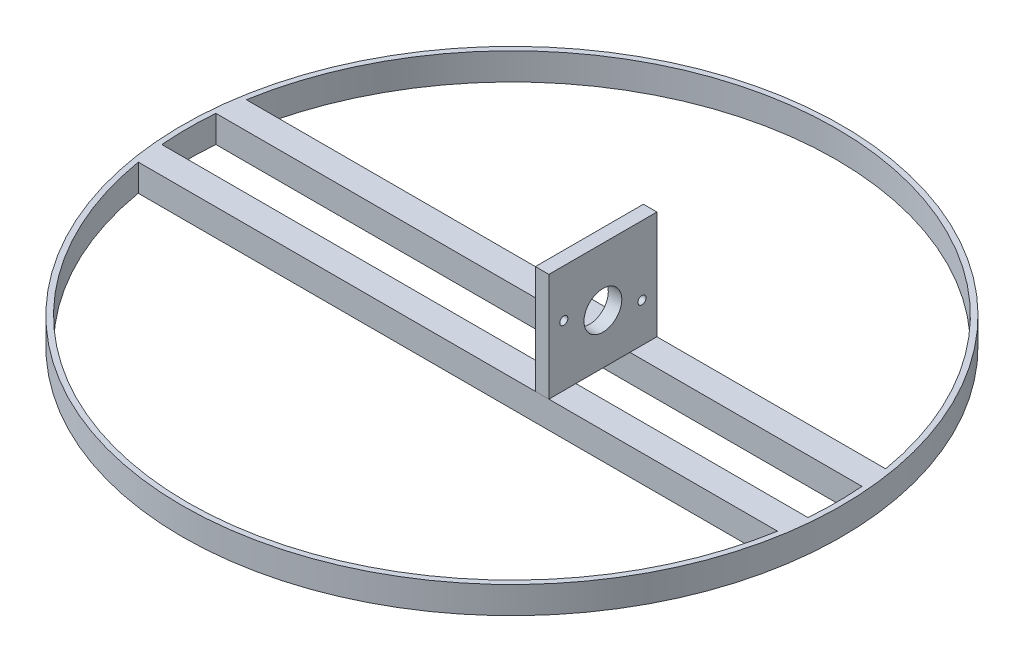
from build123d import *

# Parameters (mm, degrees)
SKETCH1_R               = 122
SKETCH1_R_2             = 120
BOSS_EXTRUDE1_DEPTH     = 10
SKETCH2_W               = 10
SKETCH2_H               = 10
BOSS_EXTRUDE2_DEPTH     = 300
CUT_EXTRUDE5_DEPTH      = 374.854124119
CUT_EXTRUDE5_DEPTH_BACK = 374.854124119
SKETCH3_OUTSIDE_W       = 379.366
SKETCH3_OUTSIDE_H       = 323.366
SKETCH3_OUTSIDE_R       = 122
BOSS_EXTRUDE3_START     = -105
SKETCH4_W               = 40
SKETCH4_H               = 40
SKETCH4_R               = 1.5
SKETCH4_R_2             = 7
BOSS_EXTRUDE3_DEPTH     = 5


with BuildPart() as part:
    # Sketch1 → Boss-Extrude1 (new body)
    with BuildSketch(Plane(origin=(0, 0, 0), x_dir=(1, 0, 0), z_dir=(0, 1, 0))):
        with Locations((-133.671737878, -100.860732568)):
            Circle(SKETCH1_R)
        with Locations((-133.671737878, -100.860732568)):
            Circle(SKETCH1_R_2, mode=Mode.SUBTRACT)
    extrude(amount=BOSS_EXTRUDE1_DEPTH)

    # Sketch2 → Boss-Extrude2 (add)
    with BuildSketch(Plane(origin=(0, 0, 0), x_dir=(0, 0, -1), z_dir=(1, 0, 0))):
        with Locations((-115.860732568, 5)):
            Rectangle(SKETCH2_W, SKETCH2_H)
        with Locations((-85.860732568, 5)):
            Rectangle(SKETCH2_W, SKETCH2_H)
    extrude(amount=-BOSS_EXTRUDE2_DEPTH)

    # Sketch3 outside → Cut-Extrude5 (cut, two sides: drawn at the far end of the back side and taken through both)
    with BuildSketch(Plane(origin=(0, 0, 0), x_dir=(1, 0, 0), z_dir=(0, 1, 0)).offset(-CUT_EXTRUDE5_DEPTH_BACK)):
        with Locations((-150, -100.861)):
            Rectangle(SKETCH3_OUTSIDE_W, SKETCH3_OUTSIDE_H)
        with Locations((-133.671737878, -100.860732568)):
            Circle(SKETCH3_OUTSIDE_R, mode=Mode.SUBTRACT)
    extrude(amount=CUT_EXTRUDE5_DEPTH + CUT_EXTRUDE5_DEPTH_BACK, mode=Mode.SUBTRACT)


with BuildPart() as body_2:
    # Sketch4 → Boss-Extrude3 (new body)
    with BuildSketch(Plane(origin=(0, 0, 0), x_dir=(0, 0, -1), z_dir=(1, 0, 0)).offset(BOSS_EXTRUDE3_START)):
        with Locations((-100.860732568, 30)):
            Rectangle(SKETCH4_W, SKETCH4_H)
        with Locations((-86.38915947, 24.519848777)):
            Circle(SKETCH4_R, mode=Mode.SUBTRACT)
        with Locations((-115.332305667, 32.412521849)):
            Circle(SKETCH4_R, mode=Mode.SUBTRACT)
        with Locations((-100.860732568, 28.466185313)):
            Circle(SKETCH4_R_2, mode=Mode.SUBTRACT)
    extrude(amount=BOSS_EXTRUDE3_DEPTH)


solid = Compound([part.part, body_2.part])
